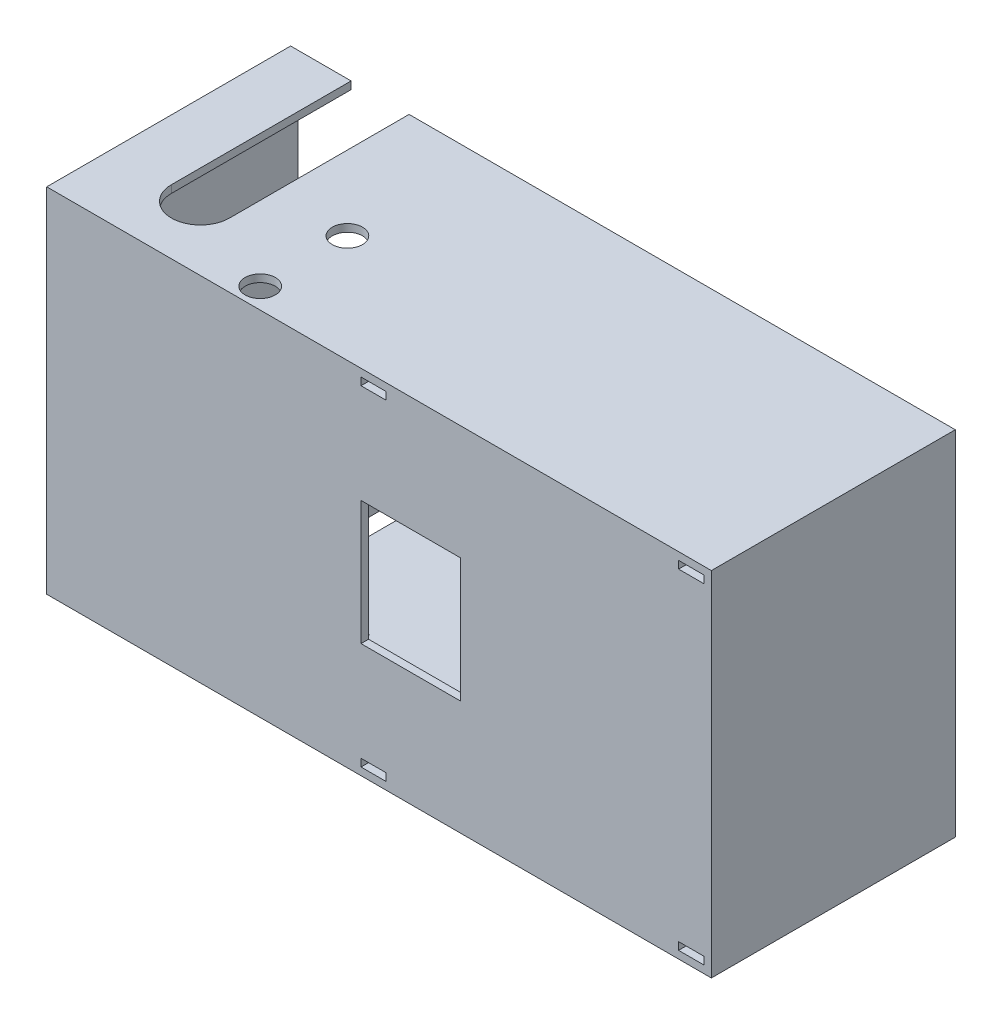
from build123d import *

# Parameters (mm, degrees)
SKETCH1_W                = 131.85
SKETCH1_H                = 70
BOSS_EXTRUDE1_DEPTH      = 1.5
SKETCH1_5_W              = 131.85
SKETCH1_5_H              = 70
SKETCH1_5_W_2            = 128.85
SKETCH1_5_H_2            = 67
BOSS_EXTRUDE2_DEPTH      = 46.887495374
SKETCH2_W                = 5.8
SKETCH2_H                = 7.525
BOSS_EXTRUDE3_DEPTH      = 67
CAVITY1_START            = -114.930353249
CAVITY1_DEPTH            = 49.266
CAVITY1_2_DEPTH          = 37.332
CAVITY1_START_2          = -120.030353249
CAVITY1_3_OUTLINE_W      = 2.55
CAVITY1_3_OUTLINE_H      = 5.1
CAVITY1_3_DEPTH          = 0.430353249
CAVITY1_START_3          = -9.75
CAVITY1_4_DEPTH          = 70
SKETCH5_W                = 8.75
SKETCH5_H                = 5
BOSS_EXTRUDE4_DEPTH      = 22.5
CUT_EXTRUDE3_REACH       = 139.739
SKETCH6_R                = 1.5
SKETCH6_R_2              = 1
CUT_EXTRUDE18_DEPTH      = 1.15
CUT_EXTRUDE18_DEPTH_BACK = 1.15
CUT_EXTRUDE18_START      = -2.5
CUT_EXTRUDE19_DEPTH      = 1.15
CUT_EXTRUDE19_DEPTH_BACK = 1.15
CUT_EXTRUDE19_START      = -19.7
SKETCH9_W                = 32.1
SKETCH9_H                = 12.2
SKETCH9_W_2              = 3.3625
BOSS_EXTRUDE5_DEPTH      = 40.087495374
SKETCH10_W               = 22.5
SKETCH10_H               = 15.7
CUT_EXTRUDE6_DEPTH       = 12.2
SKETCH11_R               = 0.75
CUT_EXTRUDE7_DEPTH       = 8
CUT_EXTRUDE9_REACH       = 149.525
SKETCH17_W               = 2.4375
SKETCH17_H               = 12.2
CUT_EXTRUDE13_DEPTH      = 7.525
SKETCH20_W               = 2.5
SKETCH20_H               = 3
BOSSBATTERYSTUBS_DEPTH   = 5.75
MIRROR10_COPY_1_SKETCH_W = 2.5
MIRROR10_COPY_1_SKETCH_H = 3
MIRROR10_COPY_1_DEPTH    = 5.75
SKETCH21_W               = 8
SKETCH21_H               = 4.2
BOSS_EXTRUDE6_DEPTH      = 1.35
MIRROR12_COPY_1_SKETCH_W = 8
MIRROR12_COPY_1_SKETCH_H = 4.2
MIRROR12_COPY_1_DEPTH    = 1.35
CUT_EXTRUDE16_REACH      = 145.655
SKETCH22_W               = 5
SKETCH22_H               = 1.5
SKETCH23_W               = 5
SKETCH23_H               = 1.5
CUT_EXTRUDE17_DEPTH      = 3
CUT_EXTRUDE23_REACH      = 145.156
SKETCH27_W               = 19.75
SKETCH27_H               = 24.6
CUT_EXTRUDE15_START      = -5.25
SKETCH19_R               = 3
CUT_EXTRUDE15_DEPTH      = 5.25
CUT_EXTRUDE24_START      = -5.25
SKETCH28_R               = 3
CUT_EXTRUDE24_DEPTH      = 5.25
CUT_EXTRUDE25_REACH      = 117.926
SKETCH29_W               = 8
SKETCH29_H               = 3
SKETCH30_W               = 5.1
SKETCH30_H               = 2.55
BOSSFRONTCAVITYFIX_DEPTH = 0.430353249
CUT_EXTRUDE26_DEPTH      = 4.8


# Read off the part's stored shape, not the designer's step: Cavity1
with BuildPart() as part:
    # Sketch1 → Boss-Extrude1 (new body)
    with BuildSketch(Plane.XY):
        with Locations((-55.175, 25.25)):
            Rectangle(SKETCH1_W, SKETCH1_H)
    extrude(amount=BOSS_EXTRUDE1_DEPTH)

    # Sketch1<5> → Boss-Extrude2 (add)
    with BuildSketch(Plane.XY):
        with Locations((-55.175, 25.25)):
            Rectangle(SKETCH1_5_W, SKETCH1_5_H)
        with Locations((-55.175, 25.25)):
            Rectangle(SKETCH1_5_W_2, SKETCH1_5_H_2, mode=Mode.SUBTRACT)
    extrude(amount=-BOSS_EXTRUDE2_DEPTH)

    # Sketch2 → Boss-Extrude3 (add)
    with BuildSketch(Plane.XZ.offset(-58.75)):
        with Locations((-76.95, -3.7625)):
            Rectangle(SKETCH2_W, SKETCH2_H)
    extrude(amount=BOSS_EXTRUDE3_DEPTH)

    # Cavity1 outline → Cavity1 (cut)
    with BuildSketch(Plane.YZ.offset(CAVITY1_START)):
        with BuildLine():
            Line((36.166540929, -4.011412776), (36.166540929, -7.525))
            Line((36.166540929, -7.525), (53.710540929, -7.525))
            Line((53.710540929, -7.525), (53.710540929, -4.011412776))
            ThreePointArc((53.710540929, -4.011412776), (44.938540929, 0.123), (36.166540929, -4.011412776))
        make_face()
        with BuildLine():
            Line((14.333459071, -7.525), (14.333459071, -4.011412776))
            ThreePointArc((14.333459071, -4.011412776), (5.561459071, 0.123), (-3.210540929, -4.011412776))
            Line((-3.210540929, -4.011412776), (-3.210540929, -7.525))
            Line((-3.210540929, -7.525), (14.333459071, -7.525))
        make_face()
    extrude(amount=CAVITY1_DEPTH, mode=Mode.SUBTRACT)

    # Cavity1 2 outline → Cavity1 2 (cut)
    with BuildSketch(Plane.YZ.offset(CAVITY1_START)):
        with BuildLine():
            Line((55.189540929, 0.225), (36.166540929, 0.225))
            Line((36.166540929, 0.225), (36.166540929, -4.011412776))
            ThreePointArc((36.166540929, -4.011412776), (44.938540929, 0.123), (53.710540929, -4.011412776))
            Line((53.710540929, -4.011412776), (53.710540929, -7.525))
            Line((53.710540929, -7.525), (55.189540929, -7.525))
            Line((55.189540929, -7.525), (55.189540929, 0.225))
        make_face()
        with BuildLine():
            Line((14.333459071, -4.011412776), (14.333459071, 0.225))
            Line((14.333459071, 0.225), (-4.689540929, 0.225))
            Line((-4.689540929, 0.225), (-4.689540929, -7.525))
            Line((-4.689540929, -7.525), (-3.210540929, -7.525))
            Line((-3.210540929, -7.525), (-3.210540929, -4.011412776))
            ThreePointArc((-3.210540929, -4.011412776), (5.561459071, 0.123), (14.333459071, -4.011412776))
        make_face()
    extrude(amount=CAVITY1_2_DEPTH, mode=Mode.SUBTRACT)

    # Cavity1 3 outline → Cavity1 3 (cut)
    with BuildSketch(Plane.YZ.offset(CAVITY1_START_2)):
        with Locations((44.938540929, -11.25)):
            Rectangle(CAVITY1_3_OUTLINE_W, CAVITY1_3_OUTLINE_H)
        with Locations((5.561459071, -11.25)):
            Rectangle(CAVITY1_3_OUTLINE_W, CAVITY1_3_OUTLINE_H)
    extrude(amount=CAVITY1_3_DEPTH, mode=Mode.SUBTRACT)

    # Cavity1 4 outline → Cavity1 4 (cut)
    with BuildSketch(Plane(origin=(0, 0, 0), x_dir=(1, 0, 0), z_dir=(0, 1, 0)).offset(CAVITY1_START_3)):
        with BuildLine():
            Line((-105.571853249, 13.174532151), (-105.571853249, 9.325467849))
            ThreePointArc((-105.571853249, 9.325467849), (-103.710353249, 8.5725), (-101.848853249, 9.325467849))
            Line((-101.848853249, 9.325467849), (-101.848853249, 13.174532151))
            ThreePointArc((-101.848853249, 13.174532151), (-103.710353249, 13.9275), (-105.571853249, 13.174532151))
        make_face()
    extrude(amount=CAVITY1_4_DEPTH, mode=Mode.SUBTRACT)

    # Sketch5 → Boss-Extrude4 (add)
    with BuildSketch(Plane(origin=(0, 0, 0), x_dir=(-1, 0, 0), z_dir=(0, 0, -1))):
        with Locations((82.85, 33.85)):
            Rectangle(SKETCH5_W, SKETCH5_H)
    boss_extrude4 = extrude(amount=BOSS_EXTRUDE4_DEPTH)

    # Sketch6 → Cut-Extrude3 (cut, up to next)
    with BuildSketch(Plane(origin=(0, 36.166540929, 0), x_dir=(1, 0, 0), z_dir=(0, 1, 0)), mode=Mode.PRIVATE) as cut_extrude3_sk1:
        with Locations(Location((-82.85, 19.9, 0), (0, 0, 270))):
            Circle(SKETCH6_R)
    cut_extrude3_tool1 = extrude(cut_extrude3_sk1.sketch, amount=-CUT_EXTRUDE3_REACH, mode=Mode.PRIVATE) & part.part
    # Sketch6 → Cut-Extrude3 (cut, up to next)
    with BuildSketch(Plane(origin=(0, 36.166540929, 0), x_dir=(1, 0, 0), z_dir=(0, 1, 0)), mode=Mode.PRIVATE) as cut_extrude3_sk2:
        with Locations(Location((-82.85, 2.6, 0), (0, 0, 270))):
            Circle(SKETCH6_R_2)
    cut_extrude3_tool2 = extrude(cut_extrude3_sk2.sketch, amount=-CUT_EXTRUDE3_REACH, mode=Mode.PRIVATE) & part.part
    cut_extrude3_1 = cut_extrude3_tool1.solids().sort_by_distance((-82.85, 36.166541, -19.9))[0]
    add(cut_extrude3_1, mode=Mode.SUBTRACT)
    cut_extrude3_2 = cut_extrude3_tool2.solids().sort_by_distance((-82.85, 36.166541, -2.6))[0]
    add(cut_extrude3_2, mode=Mode.SUBTRACT)
    cut_extrude3 = cut_extrude3_1 + cut_extrude3_2  # Cut-Extrude3 as one shape, for the pattern or mirror that repeats it

    # Sketch24 → Cut-Extrude18 (cut, two sides: drawn at the far end of the back side and taken through both)
    with BuildSketch(Plane(origin=(0, 36.35, 0), x_dir=(1, 0, 0), z_dir=(0, 1, 0)).offset(CUT_EXTRUDE18_START - CUT_EXTRUDE18_DEPTH_BACK)):
        Polygon((-82.85, 16.637970979), (-80.025, 18.26898549), (-80.025, 22.5), (-85.675, 22.5), (-85.675, 18.26898549), align=None)
    extrude(amount=CUT_EXTRUDE18_DEPTH + CUT_EXTRUDE18_DEPTH_BACK, mode=Mode.SUBTRACT)

    # Mirror15: Boss-Extrude4, Cut-Extrude3 across plane
    add(boss_extrude4.mirror(Plane(origin=(0, 25.25, 0), x_dir=(0, 0, 1), z_dir=(0, -1, 0))))
    add(cut_extrude3.mirror(Plane(origin=(0, 25.25, 0), x_dir=(0, 0, 1), z_dir=(0, -1, 0))), mode=Mode.SUBTRACT)

    # Sketch24<2> → Cut-Extrude19 (cut, two sides: drawn at the far end of the back side and taken through both)
    with BuildSketch(Plane(origin=(0, 36.35, 0), x_dir=(1, 0, 0), z_dir=(0, 1, 0)).offset(CUT_EXTRUDE19_START - CUT_EXTRUDE19_DEPTH_BACK)):
        Polygon((-82.85, 16.637970979), (-80.025, 18.26898549), (-80.025, 22.5), (-85.675, 22.5), (-85.675, 18.26898549), align=None)
    extrude(amount=CUT_EXTRUDE19_DEPTH + CUT_EXTRUDE19_DEPTH_BACK, mode=Mode.SUBTRACT)

    # Sketch9 → Boss-Extrude5 (add)
    with BuildSketch(Plane(origin=(0, 0, 0), x_dir=(-1, 0, 0), z_dir=(0, 0, -1))):
        with Locations((92.5375, 25.25)):
            Rectangle(SKETCH9_W, SKETCH9_H)
        with Locations((78.16875, 25.25)):
            Rectangle(SKETCH9_W_2, SKETCH9_H)
    extrude(amount=BOSS_EXTRUDE5_DEPTH)

    # Sketch10 → Cut-Extrude6 (cut)
    with BuildSketch(Plane(origin=(0, 31.35, 0), x_dir=(1, 0, 0), z_dir=(0, 1, 0))):
        with Locations((-92.5375, 32.237495374)):
            Rectangle(SKETCH10_W, SKETCH10_H)
    extrude(amount=-CUT_EXTRUDE6_DEPTH, mode=Mode.SUBTRACT)

    # Sketch11 → Cut-Extrude7 (cut)
    with BuildSketch(Plane(origin=(0, 0, -40.087495374), x_dir=(-1, 0, 0), z_dir=(0, 0, -1))):
        with Locations((106.1875, 25.25)):
            Circle(SKETCH11_R)
    cut_extrude7 = extrude(amount=-CUT_EXTRUDE7_DEPTH, mode=Mode.SUBTRACT)

    # Sketch13 → Cut-Extrude9 (cut, up to next)
    with BuildSketch(Plane(origin=(0, 60.25, 0), x_dir=(1, 0, 0), z_dir=(0, 1, 0)), mode=Mode.PRIVATE) as cut_extrude9_sk1:
        with BuildLine():
            Line((-109.1, 46.887495374), (-109.1, 11.25))
            ThreePointArc((-109.1, 11.25), (-103.35, 5.5), (-97.6, 11.25))
            Line((-97.6, 11.25), (-97.6, 46.887495374))
            Line((-97.6, 46.887495374), (-109.1, 46.887495374))
        make_face()
        with BuildLine():
            Line((-105.571853249, 9.325467849), (-105.571853249, 13.174532151))
            ThreePointArc((-105.571853249, 13.174532151), (-103.710353249, 13.9275), (-101.848853249, 13.174532151))
            Line((-101.848853249, 13.174532151), (-101.848853249, 9.325467849))
            ThreePointArc((-101.848853249, 9.325467849), (-103.710353249, 8.5725), (-105.571853249, 9.325467849))
        make_face(mode=Mode.SUBTRACT)
    cut_extrude9_tool1 = extrude(cut_extrude9_sk1.sketch, amount=-CUT_EXTRUDE9_REACH, mode=Mode.PRIVATE) & part.part
    cut_extrude9 = cut_extrude9_tool1.solids().sort_by_distance((-103.335225, 60.25, -27.427392))[0]
    add(cut_extrude9, mode=Mode.SUBTRACT)

    # Mirror4: Cut-Extrude9 across plane
    add(cut_extrude9.mirror(Plane(origin=(0, 25.25, 0), x_dir=(0, 0, 1), z_dir=(0, -1, 0))), mode=Mode.SUBTRACT)

    # Sketch17 → Cut-Extrude13 (cut)
    with BuildSketch(Plane(origin=(0, 0, -7.525), x_dir=(-1, 0, 0), z_dir=(0, 0, -1))):
        with Locations((75.26875, 25.25)):
            Rectangle(SKETCH17_W, SKETCH17_H)
    extrude(amount=-CUT_EXTRUDE13_DEPTH, mode=Mode.SUBTRACT)

    # Sketch20 → BossBatteryStubs (add)
    with BuildSketch(Plane(origin=(0, 0, 0), x_dir=(-1, 0, 0), z_dir=(0, 0, -1))):
        with Locations((29.25, 57.25)):
            Rectangle(SKETCH20_W, SKETCH20_H)
    bossbatterystubs = extrude(amount=BOSSBATTERYSTUBS_DEPTH)

    # Mirror9: BossBatteryStubs across plane
    add(bossbatterystubs.mirror(Plane.ZY.offset(19.5)))

    # Mirror10: BossBatteryStubs across plane
    add(bossbatterystubs.mirror(Plane(origin=(0, 25.25, 0), x_dir=(0, 0, 1), z_dir=(0, -1, 0))))

    # Mirror10 copy 1 sketch → Mirror10 copy 1 (add)
    with BuildSketch(Plane(origin=(-39, 50.5, 0), x_dir=(1, 0, 0), z_dir=(0, 0, -1))):
        with Locations((29.25, 57.25)):
            Rectangle(MIRROR10_COPY_1_SKETCH_W, MIRROR10_COPY_1_SKETCH_H)
    extrude(amount=MIRROR10_COPY_1_DEPTH)

    # Sketch21 → Boss-Extrude6 (add)
    with BuildSketch(Plane.XZ.offset(-58.75)):
        with Locations((5.25, -41.637495374)):
            Rectangle(SKETCH21_W, SKETCH21_H)
    boss_extrude6 = extrude(amount=BOSS_EXTRUDE6_DEPTH)

    # Mirror11: Boss-Extrude6 across plane
    add(boss_extrude6.mirror(Plane(origin=(-55.175, 0, 0), x_dir=(0, 0, 1), z_dir=(1, 0, 0))))

    # Mirror12: Boss-Extrude6 across plane
    add(boss_extrude6.mirror(Plane(origin=(0, 25.25, 0), x_dir=(0, 0, 1), z_dir=(0, -1, 0))))

    # Mirror12 copy 1 sketch → Mirror12 copy 1 (add)
    with BuildSketch(Plane(origin=(-110.35, -8.25, 0), x_dir=(-1, 0, 0), z_dir=(0, 1, 0))):
        with Locations((5.25, -41.637495374)):
            Rectangle(MIRROR12_COPY_1_SKETCH_W, MIRROR12_COPY_1_SKETCH_H)
    extrude(amount=MIRROR12_COPY_1_DEPTH)

    # Sketch22 → Cut-Extrude16 (cut, up to next)
    with BuildSketch(Plane.XY.offset(1.5), mode=Mode.PRIVATE) as cut_extrude16_sk1:
        with Locations((6.75, 58)):
            Rectangle(SKETCH22_W, SKETCH22_H)
    cut_extrude16_tool1 = extrude(cut_extrude16_sk1.sketch, amount=-CUT_EXTRUDE16_REACH, mode=Mode.PRIVATE) & part.part
    cut_extrude16 = cut_extrude16_tool1.solids().sort_by_distance((6.75, 58, 1.5))[0]
    add(cut_extrude16, mode=Mode.SUBTRACT)

    # Sketch23 → Cut-Extrude17 (cut)
    with BuildSketch(Plane.XY.offset(1.5)):
        with Locations((-56.25, 58)):
            Rectangle(SKETCH23_W, SKETCH23_H)
    cut_extrude17 = extrude(amount=-CUT_EXTRUDE17_DEPTH, mode=Mode.SUBTRACT)

    # Mirror13: Cut-Extrude16, Cut-Extrude17 across plane
    add(cut_extrude16.mirror(Plane(origin=(0, 25.25, 0), x_dir=(0, 0, 1), z_dir=(0, -1, 0))), mode=Mode.SUBTRACT)
    add(cut_extrude17.mirror(Plane(origin=(0, 25.25, 0), x_dir=(0, 0, 1), z_dir=(0, -1, 0))), mode=Mode.SUBTRACT)

    # Mirror14: Cut-Extrude7 across plane
    add(cut_extrude7.mirror(Plane(origin=(-92.5375, 0, 0), x_dir=(0, 0, 1), z_dir=(1, 0, 0))), mode=Mode.SUBTRACT)

    # Sketch27 → Cut-Extrude23 (cut, up to next)
    with BuildSketch(Plane(origin=(0, 0, 0), x_dir=(-1, 0, 0), z_dir=(0, 0, -1)), mode=Mode.PRIVATE) as cut_extrude23_sk1:
        with Locations((48.875, 25.25)):
            Rectangle(SKETCH27_W, SKETCH27_H)
    cut_extrude23_tool1 = extrude(cut_extrude23_sk1.sketch, amount=-CUT_EXTRUDE23_REACH, mode=Mode.PRIVATE) & part.part
    add(cut_extrude23_tool1.solids().sort_by_distance((-48.875, 25.25, 0))[0], mode=Mode.SUBTRACT)

    # Sketch19 → Cut-Extrude15 (cut)
    with BuildSketch(Plane.XZ.offset(9.75).offset(CUT_EXTRUDE15_START)):
        with Locations((-82.85, -19.9)):
            Circle(SKETCH19_R)
        with Locations((-82.85, -2.6)):
            Circle(SKETCH19_R)
    extrude(amount=CUT_EXTRUDE15_DEPTH, mode=Mode.SUBTRACT)

    # Sketch28 → Cut-Extrude24 (cut)
    with BuildSketch(Plane(origin=(0, 60.25, 0), x_dir=(1, 0, 0), z_dir=(0, 1, 0)).offset(CUT_EXTRUDE24_START)):
        with Locations((-82.85, 19.9)):
            Circle(SKETCH28_R)
        with Locations((-82.85, 2.6)):
            Circle(SKETCH28_R)
    extrude(amount=CUT_EXTRUDE24_DEPTH, mode=Mode.SUBTRACT)

    # Sketch29 → Cut-Extrude25 (cut, up to next)
    with BuildSketch(Plane(origin=(-76.4875, 0, 0), x_dir=(0, 0, -1), z_dir=(1, 0, 0)), mode=Mode.PRIVATE) as cut_extrude25_sk1:
        with Locations((28.387495374, 25.25)):
            Rectangle(SKETCH29_W, SKETCH29_H)
    cut_extrude25_tool1 = extrude(cut_extrude25_sk1.sketch, amount=-CUT_EXTRUDE25_REACH, mode=Mode.PRIVATE) & part.part
    add(cut_extrude25_tool1.solids().sort_by_distance((-76.4875, 25.25, -28.387495))[0], mode=Mode.SUBTRACT)

    # Sketch30 → BossFrontCavityFix (add)
    with BuildSketch(Plane(origin=(-120.030353249, 0, 0), x_dir=(0, 0, -1), z_dir=(1, 0, 0))):
        with Locations((11.25, 44.938540929)):
            Rectangle(SKETCH30_W, SKETCH30_H)
        with Locations((11.25, 5.561459071)):
            Rectangle(SKETCH30_W, SKETCH30_H)
    extrude(amount=BOSSFRONTCAVITYFIX_DEPTH)

    # Sketch31 → Cut-Extrude26 (cut)
    with BuildSketch(Plane(origin=(-76.4875, 0, 0), x_dir=(0, 0, -1), z_dir=(1, 0, 0))):
        Polygon((40.087495374, 19.15), (28.387495374, 19.15), (28.387495374, 23.75), (28.387495374, 26.75), (28.387495374, 31.35), (40.087495374, 31.35), align=None)
    extrude(amount=-CUT_EXTRUDE26_DEPTH, mode=Mode.SUBTRACT)


solid = part.part
